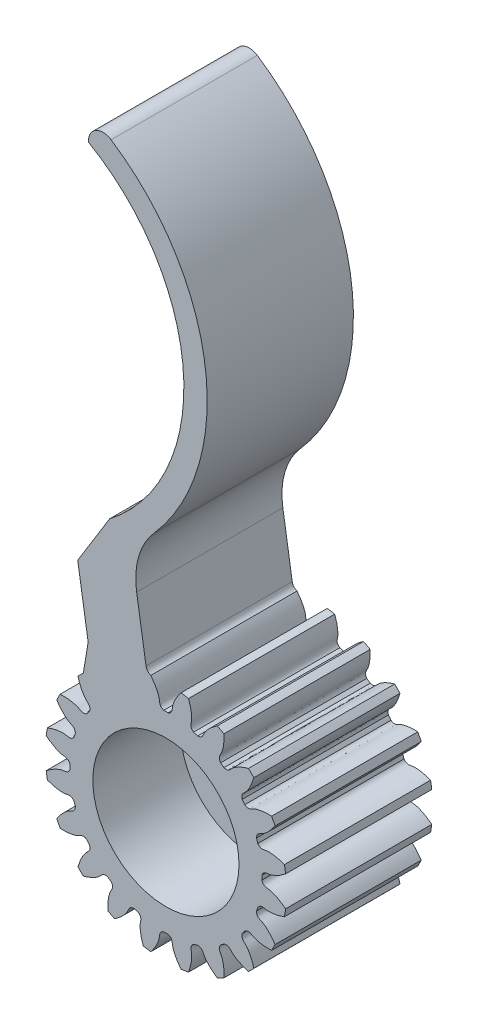
from build123d import *

# Parameters (mm, degrees)
SKETCH_1_R               = 16.5
EXTRUDE_1_DEPTH          = 20
CUT_EXTRUDE_1_DEPTH      = 31.732718721
PATTERN_CIRCULAR_1_COUNT = 20
EXTRUDE_START            = -20
EXTRUDE_2_DEPTH          = 20
FILLET_1_R               = 1
FILLET_2_R               = 2
FILLET_4_R               = 10
SKETCH_5_R               = 2
CUT_EXTRUDE_2_DEPTH      = 20
SKETCH_6_R               = 10
CUT_EXTRUDE_3_DEPTH      = 12
SKETCH_7_R               = 4.5
SKETCH_7_R_2             = 2
EXTRUDE_3_DEPTH          = 4.5
FILLET_5_R               = 1


with BuildPart() as part:
    # 草图1 → 凸台-拉伸1 (new body)
    with BuildSketch(Plane.XY):
        Circle(SKETCH_1_R)
    extrude(amount=EXTRUDE_1_DEPTH)

    # 草图2 → 切除-拉伸1 (cut, through all)
    with BuildSketch(Plane.XY):
        with BuildLine():
            ThreePointArc((0.289974901, 13.121796354), (0, 13.125), (-0.289974901, 13.121796354))
            add(Edge.make_bspline(
                [(-0.289974901, 13.121796354), (-0.916784107, 13.340213268), (-0.835626149, 13.780670548), (-0.919345585, 14.205014104), (-0.928338279, 14.246334921), (-0.939466335, 14.292951923), (-0.952938145, 14.344795254), (-0.96896871, 14.401787245), (-0.987768083, 14.463844242), (-1.009544807, 14.5308761), (-1.034504625, 14.602786421), (-1.06285065, 14.679472568), (-1.094783098, 14.760825751), (-1.130499153, 14.846731096), (-1.170192797, 14.937067727), (-1.214054647, 15.031708847), (-1.2622718, 15.130521826), (-1.315027675, 15.233368292), (-1.372501858, 15.340104225), (-1.434869948, 15.450580056), (-1.502303414, 15.564640771), (-1.574969439, 15.682126017), (-1.653030782, 15.802870208), (-1.736645634, 15.926702646), (-1.825967477, 16.05344763), (-1.921144951, 16.182924586), (-2.022321721, 16.314948181), (-2.129636342, 16.449328459), (-2.24322214, 16.585870967), (-2.363207078, 16.724376892), (-2.489713645, 16.864643194), (-2.622858733, 17.006462752), (-2.762753527, 17.149624504), (-2.909503389, 17.29391359), (-3.06320776, 17.439111509), (-3.223960048, 17.584996263), (-3.391847534, 17.731342516), (-3.566951278, 17.877921749), (-3.749346018, 18.024502419), (-3.939100102, 18.170850122), (-4.136275349, 18.31672776), (-4.412210386, 18.512459802), (-4.625898619, 18.654498902), (-4.771736973, 18.747377789)],
                knots=[0, 0, 0, 0, 0.165916003, 0.170905922, 0.176663519, 0.183188797, 0.190481754, 0.198542391, 0.207370708, 0.216966704, 0.22733038, 0.238461736, 0.250360771, 0.263027487, 0.276461881, 0.290663956, 0.30563371, 0.321371144, 0.337876258, 0.355149051, 0.373189524, 0.391997677, 0.411573509, 0.431917021, 0.453028213, 0.474907084, 0.497553636, 0.520967867, 0.545149777, 0.570099367, 0.595816637, 0.622301587, 0.649554216, 0.677574526, 0.706362514, 0.735918183, 0.766241531, 0.797332559, 0.829191267, 0.861817654, 0.895211721, 0.929373468, 1, 1, 1, 1], degree=3))
            ThreePointArc((-4.771736973, 18.747377789), (0, 19.345119481), (4.771736973, 18.747377789))
            add(Edge.make_bspline(
                [(0.289974901, 13.121796354), (0.916784107, 13.340213268), (0.835626149, 13.780670548), (0.919345585, 14.205014104), (0.928338279, 14.246334921), (0.939466335, 14.292951923), (0.952938145, 14.344795254), (0.96896871, 14.401787245), (0.987768083, 14.463844242), (1.009544807, 14.5308761), (1.034504625, 14.602786421), (1.06285065, 14.679472568), (1.094783098, 14.760825751), (1.130499153, 14.846731096), (1.170192797, 14.937067727), (1.214054647, 15.031708847), (1.2622718, 15.130521826), (1.315027675, 15.233368292), (1.372501858, 15.340104225), (1.434869948, 15.450580056), (1.502303414, 15.564640771), (1.574969439, 15.682126017), (1.653030782, 15.802870208), (1.736645634, 15.926702646), (1.825967477, 16.05344763), (1.921144951, 16.182924586), (2.022321721, 16.314948181), (2.129636342, 16.449328459), (2.24322214, 16.585870967), (2.363207078, 16.724376892), (2.489713645, 16.864643194), (2.622858733, 17.006462752), (2.762753527, 17.149624504), (2.909503389, 17.29391359), (3.06320776, 17.439111509), (3.223960048, 17.584996263), (3.391847534, 17.731342516), (3.566951278, 17.877921749), (3.749346018, 18.024502419), (3.939100102, 18.170850122), (4.136275349, 18.31672776), (4.412210386, 18.512459802), (4.625898619, 18.654498902), (4.771736973, 18.747377789)],
                knots=[0, 0, 0, 0, 0.165916003, 0.170905922, 0.176663519, 0.183188797, 0.190481754, 0.198542391, 0.207370708, 0.216966704, 0.22733038, 0.238461736, 0.250360771, 0.263027487, 0.276461881, 0.290663956, 0.30563371, 0.321371144, 0.337876258, 0.355149051, 0.373189524, 0.391997677, 0.411573509, 0.431917021, 0.453028213, 0.474907084, 0.497553636, 0.520967867, 0.545149777, 0.570099367, 0.595816637, 0.622301587, 0.649554216, 0.677574526, 0.706362514, 0.735918183, 0.766241531, 0.797332559, 0.829191267, 0.861817654, 0.895211721, 0.929373468, 1, 1, 1, 1], degree=3))
        make_face()
    cut_extrude_1 = extrude(amount=CUT_EXTRUDE_1_DEPTH, mode=Mode.SUBTRACT)

    # 阵列(圆周)1: 切除-拉伸1 ×20 about axis
    pattern_circular_1_axis = Axis((0, 0, -1.5), (0, 0, 1))
    for i in range(1, PATTERN_CIRCULAR_1_COUNT):
        add(cut_extrude_1.rotate(pattern_circular_1_axis, i * 360 / PATTERN_CIRCULAR_1_COUNT), mode=Mode.SUBTRACT)


with BuildPart() as extrude_2_tool:
    # 草图4 → 凸台-拉伸2 (new body)
    with BuildSketch(Plane.XY.offset(20).offset(EXTRUDE_START)):
        with BuildLine():
            ThreePointArc((-10.585309869, 75.270801181), (2.434492626, 51.533585521), (-12.707173491, 29.090310103))
            Line((-12.707173491, 29.090310103), (-10.638462888, 16.028985398))
            Line((-10.638462888, 16.028985398), (-9.921456121, 11.501982843))
            add(Edge.make_bspline(
                [(-9.921456121, 11.501982843), (-9.918703082, 11.500559653), (-9.852537081, 11.466286234), (-9.730890834, 11.400191512), (-9.589612349, 11.315967266), (-9.466858859, 11.237556123), (-9.37982057, 11.17834971), (-9.300755502, 11.120900284), (-9.249070303, 11.081745113), (-9.202602252, 11.045060153), (-9.150343301, 11.002082969), (-9.104978437, 10.962582681), (-8.776110671, 10.657627941), (-8.582874544, 10.253587065), (-7.947393003, 10.445313277)],
                knots=[0.69310037, 0.69310037, 0.69310037, 0.69310037, 0.69436629, 0.723538119, 0.749639229, 0.761538264, 0.783033296, 0.792629292, 0.801457609, 0.809518246, 0.816811203, 0.829094078, 0.834083997, 1, 1, 1, 1], degree=3))
            ThreePointArc((-7.947393003, 10.445313277), (-7.714681436, 10.618348051), (-7.478203758, 10.786199217))
            add(Edge.make_bspline(
                [(-7.478203758, 10.786199217), (-7.099486698, 11.33133142), (-7.424039159, 11.639965394), (-7.612442624, 12.046973423), (-7.635991116, 12.102324233), (-7.660715943, 12.16530613), (-7.681245996, 12.220836149), (-7.71083511, 12.306060717), (-7.748703597, 12.427161912), (-7.792731572, 12.590510669), (-7.835215538, 12.777480211), (-7.874329115, 12.988173006), (-7.908236264, 13.222583157), (-7.935097524, 13.480595599), (-7.953075711, 13.761985925), (-7.960341751, 14.066420428), (-7.956565619, 14.30111124), (-7.951281332, 14.434194698), (-7.950219677, 14.458354231)],
                knots=[0, 0, 0, 0, 0.165916003, 0.170905922, 0.183188797, 0.190481754, 0.198542391, 0.207370708, 0.22733038, 0.250360771, 0.276461881, 0.30563371, 0.337876258, 0.373189524, 0.411573509, 0.453028213, 0.497553636, 0.507431698, 0.507431698, 0.507431698, 0.507431698], degree=3))
            ThreePointArc((-7.950219677, 14.458354231), (-7.490843246, 14.701607649), (-7.024032405, 14.930270218))
            add(Edge.make_bspline(
                [(-7.024032405, 14.930270218), (-6.912948778, 14.856790614), (-6.720224904, 14.722766352), (-6.458979768, 14.52326582), (-6.24189748, 14.343324096), (-6.048949658, 14.169936981), (-5.879237949, 14.004722705), (-5.731774221, 13.849237063), (-5.623437121, 13.725477592), (-5.530921989, 13.612971249), (-5.466439445, 13.529766293), (-5.408996946, 13.450696193), (-5.371941014, 13.397485807), (-5.339083547, 13.34823692), (-5.302663012, 13.291214284), (-5.271724722, 13.239628764), (-5.053189088, 12.847973843), (-4.994266108, 12.403994888), (-4.330640589, 12.389962756)],
                knots=[0.492568302, 0.492568302, 0.492568302, 0.492568302, 0.546971787, 0.588426491, 0.626810476, 0.662123742, 0.69436629, 0.723538119, 0.749639229, 0.761538264, 0.783033296, 0.792629292, 0.801457609, 0.809518246, 0.816811203, 0.829094078, 0.834083997, 1, 1, 1, 1], degree=3))
            ThreePointArc((-4.330640589, 12.389962756), (-4.055848051, 12.482616776), (-3.779075551, 12.5691771))
            add(Edge.make_bspline(
                [(-3.779075551, 12.5691771), (-3.250439109, 12.970598627), (-3.463733699, 13.364419205), (-3.517143644, 13.809726715), (-3.522435249, 13.869645348), (-3.526487481, 13.937185083), (-3.528853002, 13.996341404), (-3.530658082, 14.086538325), (-3.529250826, 14.213414411), (-3.520646377, 14.382373703), (-3.503274264, 14.573320573), (-3.475365832, 14.785788088), (-3.435176726, 15.019203275), (-3.380993074, 15.272888275), (-3.311136952, 15.546061943), (-3.223971932, 15.837841691), (-3.147857168, 16.059879028), (-3.101706462, 16.184815984), (-3.093231062, 16.207464996)],
                knots=[0, 0, 0, 0, 0.165916003, 0.170905922, 0.183188797, 0.190481754, 0.198542391, 0.207370708, 0.22733038, 0.250360771, 0.276461881, 0.30563371, 0.337876258, 0.373189524, 0.411573509, 0.453028213, 0.497553636, 0.507431698, 0.507431698, 0.507431698, 0.507431698], degree=3))
            Line((-3.093231062, 16.207464996), (-2.581168673, 16.29685762))
            Line((-2.581168673, 16.29685762), (-4.805666766, 30.341785823))
            ThreePointArc((-4.805666766, 30.341785823), (5.398938755, 56.554151755), (-11.269260032, 79.21233462))
            Line((-11.269260032, 79.21233462), (-10.585309869, 75.270801181))
        make_face()
        with BuildLine():
            Line((-9.921456121, 11.501982843), (-10.638462888, 16.028985398))
            Line((-10.638462888, 16.028985398), (-11.293959017, 12.028985398))
            add(Edge.make_bspline(
                [(-11.293959017, 12.028985398), (-11.165605763, 11.993428871), (-10.940898693, 11.925519176), (-10.630790749, 11.816512081), (-10.368728174, 11.712459448), (-10.134477341, 11.608440656), (-9.988822046, 11.536807812), (-9.921456121, 11.501982843)],
                knots=[0.492568302, 0.492568302, 0.492568302, 0.492568302, 0.546971787, 0.588426491, 0.626810476, 0.662123742, 0.69310037, 0.69310037, 0.69310037, 0.69310037], degree=3))
        make_face()
    extrude(amount=EXTRUDE_2_DEPTH)


with BuildPart() as part_1:
    add(part.part)


with BuildPart() as part_2:
    # 凸台-拉伸2: joined with extrude_2_tool
    add(part_1.part.fuse(extrude_2_tool.part, tol=0.00001))

    # 圆角1
    # the kernel refuses this fillet: 1 mm, written as the material it adds along each edge
    with BuildSketch(Plane(origin=(-2.581168673, 16.29685762, 0), x_dir=(0.9900299133467207, 0.14085727059220135, 0), z_dir=(0, 0, 1))) as fillet_1_piece_1:
        with BuildLine():
            CenterArc((0.986188646, 0.884583413), FILLET_1_R, 180.902544173, 61.297755274)
            Line((-0.013687288, 0.868831697), (-0.033684807, 0.868516662))
            Line((-0.033684807, 0.868516662), (-0.019997519, -0.000315034))
            Line((-0.019997519, -0.000315034), (0.000315034, -0.019997519))
            ThreePointArc((0.000315034, -0.019997519), (0.259903314, -0.017952911), (0.510478988, -0.017691668))
            Line((0.510478988, -0.017691668), (0.519806629, 0))
        make_face()
    extrude(amount=20)

    # 圆角2
    # the kernel refuses this fillet: 2 mm, written as the material it takes off along each edge
    with BuildSketch(Plane(origin=(-11.269260032, 79.21233462, -10.804324523), x_dir=(0.8737678183188975, -0.4863432940529091, 0), z_dir=(0, 0, 1))) as fillet_2_piece_1:
        with BuildLine():
            CenterArc((4.173669786, -1.994512028), FILLET_2_R, 85.754508866, 128.192038812)
            Line((2.514551999, -3.111350499), (2.481369643, -3.133687268))
            ThreePointArc((2.481369643, -3.133687268), (1.226165871, -1.58081804), (-0.031110128, -0.025142791))
            Line((-0.031110128, -0.025142791), (-0.0029612, 0.039890241))
            ThreePointArc((-0.0029612, 0.039890241), (2.160864905, 0.120094316), (4.32469101, 0.039890241))
            Line((4.32469101, 0.039890241), (4.321729809, 0))
        make_face()
    extrude(amount=41.608649046, mode=Mode.SUBTRACT)

    # 圆角4
    fillet_4_edges = [part_2.edges().sort_by_distance(p)[0] for p in [
        (-4.805666766, 30.341785823, 10),
    ]]
    fillet(fillet_4_edges, radius=FILLET_4_R)

    # 草图5 → 切除-拉伸2 (cut)
    with BuildSketch(Plane.XY.offset(20)):
        Circle(SKETCH_5_R)
    extrude(amount=-CUT_EXTRUDE_2_DEPTH, mode=Mode.SUBTRACT)

    # 倒角1
    # the kernel refuses this chamfer: 7.206221188, 5 mm, written as the material it takes off along each edge
    with BuildSketch(Plane(origin=(-12.707173491, 29.090310103, -15.305906315), x_dir=(0.8563189904159998, 0.5164472738362773, 0), z_dir=(0, 0, 1))) as chamfer_1_piece_1:
        with BuildLine():
            Line((6.120939246, 0.132006216), (-1.806978449, -3.952102234))
            Line((-1.806978449, -3.952102234), (-1.940519302, -3.89789255))
            ThreePointArc((-1.940519302, -3.89789255), (-0.950036223, -1.95715579), (-0.133540854, 0.054209685))
            Line((-0.133540854, 0.054209685), (0.016254723, 0.143204865))
            ThreePointArc((0.016254723, 0.143204865), (3.060904423, -0.021443994), (6.104684523, 0.275211082))
            Line((6.104684523, 0.275211082), (6.120939246, 0.132006216))
        make_face()
    extrude(amount=50.61181263, mode=Mode.SUBTRACT)

    # 草图6 → 切除-拉伸3 (cut)
    with BuildSketch(Plane.XY.offset(20)):
        Circle(SKETCH_6_R)
    extrude(amount=-CUT_EXTRUDE_3_DEPTH, mode=Mode.SUBTRACT)

    # 草图7 → 凸台-拉伸3 (add)
    with BuildSketch(Plane(origin=(0, 0, 0), x_dir=(-1, 0, 0), z_dir=(0, 0, -1))):
        with Locations(Location((0, 0, 0), (0, 0, 180))):
            Circle(SKETCH_7_R)
        with Locations(Location((0, 0, 0), (0, 0, 180))):
            Circle(SKETCH_7_R_2, mode=Mode.SUBTRACT)
    extrude(amount=EXTRUDE_3_DEPTH)

    # 圆角5
    fillet_5_edges = [part_2.edges().sort_by_distance(p)[0] for p in [
        (-4.5, 0, 0),
    ]]
    fillet(fillet_5_edges, radius=FILLET_5_R)


solid = part_2.part
